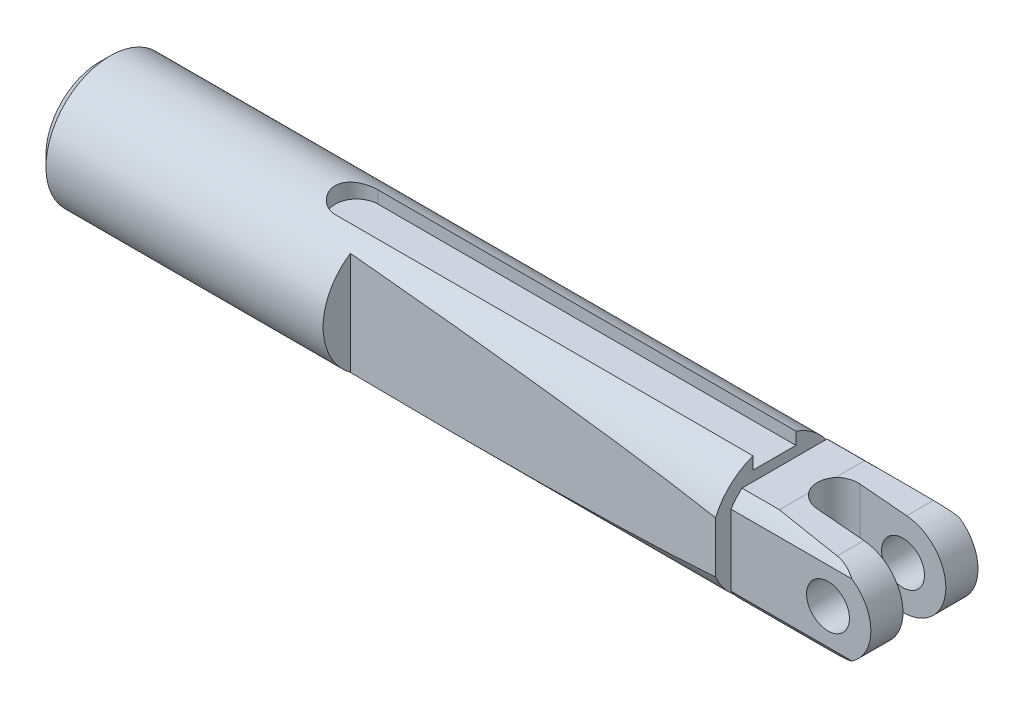
from build123d import *

# Parameters (mm, degrees)
SKIZZE1_W                            = 63
SKIZZE1_H                            = 6
SKIZZE2_W                            = 18
SKIZZE2_H                            = 14
AUFSATZ_LINEAR_AUSTRAGEN1_DEPTH      = 9
SCHNITT_LINEAR_AUSTRAGEN1_DEPTH      = 72.909665553
SCHNITT_LINEAR_AUSTRAGEN1_DEPTH_BACK = 72.909665553
SKIZZE3_R                            = 2
SCHNITT_LINEAR_AUSTRAGEN2_DEPTH      = 72.909665553
SCHNITT_LINEAR_AUSTRAGEN2_DEPTH_BACK = 72.909665553
SKIZZE4_W                            = 15
SKIZZE4_H                            = 4
SCHNITT_LINEAR_AUSTRAGEN4_DEPTH      = 72.909665553
SCHNITT_LINEAR_AUSTRAGEN4_DEPTH_BACK = 72.909665553
SCHNITT_LINEAR_AUSTRAGEN5_DEPTH      = 5
SCHNITT_LINEAR_AUSTRAGEN5_DEPTH_BACK = 65.02343321
SKIZZE9_OUTSIDE_W                    = 32.83
SKIZZE9_OUTSIDE_H                    = 36.83
SKIZZE9_OUTSIDE_R                    = 6
SKIZZE11_W                           = 0.94
SKIZZE11_H                           = 2.5
SKIZZE14_W                           = 4
SKIZZE14_H                           = 3
SCHNITT_LINEAR_AUSTRAGEN7_DEPTH      = 45
FASE1_SIZE                           = 1
SCHNITT_LINEAR_START                 = -6.0000001
SCHNITT_LINEAR_AUSTRAGEN8_DEPTH      = 12.0000001
SCHNITT_LINEAR_AUSTRAGEN9_DEPTH      = 68.535176128
SCHNITT_LINEAR_AUSTRAGEN9_DEPTH_BACK = 68.535176128
SKIZZE16_W                           = 13.06
SKIZZE16_H                           = 1
VERRUNDUNG2_R                        = 2
VERRUNDUNG3_R                        = 2
VERRUNDUNG4_R                        = 2


with BuildPart() as part:
    # Skizze1 → Rotation1 (revolve)
    with BuildSketch(Plane.XY, mode=Mode.PRIVATE) as rotation1_sk:
        with Locations((21.5, 3)):
            Rectangle(SKIZZE1_W, SKIZZE1_H)
    revolve(rotation1_sk.sketch.rotate(Axis((0, 0, 0), (1, 0, 0)), 90), axis=Axis((0, 0, 0), (1, 0, 0)))

    # Skizze2 → Aufsatz-Linear austragen1 (add, symmetric)
    with BuildSketch(Plane(origin=(0, 0, 0), x_dir=(1, 0, 0), z_dir=(0, 1, 0))):
        with Locations((62, 0)):
            Rectangle(SKIZZE2_W, SKIZZE2_H)
    extrude(amount=AUFSATZ_LINEAR_AUSTRAGEN1_DEPTH, both=True)

    # Skizze3 → Schnitt-Linear austragen1 (cut, two sides: drawn at the far end of the back side and taken through both)
    with BuildSketch(Plane.XY.offset(-SCHNITT_LINEAR_AUSTRAGEN1_DEPTH_BACK)):
        with Locations((63, 0)):
            Circle(SKIZZE3_R)
    extrude(amount=SCHNITT_LINEAR_AUSTRAGEN1_DEPTH + SCHNITT_LINEAR_AUSTRAGEN1_DEPTH_BACK, mode=Mode.SUBTRACT)

    # Skizze4 → Schnitt-Linear austragen2 (cut, two sides: drawn at the far end of the back side and taken through both)
    with BuildSketch(Plane(origin=(0, 0, 0), x_dir=(1, 0, 0), z_dir=(0, 1, 0)).offset(-SCHNITT_LINEAR_AUSTRAGEN2_DEPTH_BACK)):
        with Locations((64.5, 0)):
            Rectangle(SKIZZE4_W, SKIZZE4_H)
    extrude(amount=SCHNITT_LINEAR_AUSTRAGEN2_DEPTH + SCHNITT_LINEAR_AUSTRAGEN2_DEPTH_BACK, mode=Mode.SUBTRACT)

    # Skizze7 → Schnitt-Linear austragen4 (cut, two sides: drawn at the far end of the back side and taken through both)
    with BuildSketch(Plane(origin=(0, 0, 0), x_dir=(1, 0, 0), z_dir=(0, 1, 0)).offset(-SCHNITT_LINEAR_AUSTRAGEN4_DEPTH_BACK)):
        Polygon((53, -5.5), (17, -3.580275313), (16.870966522, -6), (53, -6), align=None)
    extrude(amount=SCHNITT_LINEAR_AUSTRAGEN4_DEPTH + SCHNITT_LINEAR_AUSTRAGEN4_DEPTH_BACK, mode=Mode.SUBTRACT)

    # Skizze9 outside → Schnitt-Linear austragen5 (cut, two sides: drawn at the far end of the back side and taken through both)
    with BuildSketch(Plane.ZY.offset(-53).offset(-SCHNITT_LINEAR_AUSTRAGEN5_DEPTH_BACK)):
        Rectangle(SKIZZE9_OUTSIDE_W, SKIZZE9_OUTSIDE_H)
        Circle(SKIZZE9_OUTSIDE_R, mode=Mode.SUBTRACT)
    extrude(amount=SCHNITT_LINEAR_AUSTRAGEN5_DEPTH + SCHNITT_LINEAR_AUSTRAGEN5_DEPTH_BACK, mode=Mode.SUBTRACT)

    # Skizze11 → Schnitt-Rotation1 (revolve, cut)
    with BuildSketch(Plane.XY, mode=Mode.PRIVATE) as schnitt_rotation1_sk:
        with Locations((53.47, 4.75)):
            Rectangle(SKIZZE11_W, SKIZZE11_H)
    revolve(schnitt_rotation1_sk.sketch.rotate(Axis((0, 0, 0), (1, 0, 0)), 90), axis=Axis((0, 0, 0), (1, 0, 0)), mode=Mode.SUBTRACT)

    # Skizze14 → Schnitt-Linear austragen7 (cut)
    with BuildSketch(Plane(origin=(57, 0, 0), x_dir=(0, 0, -1), z_dir=(1, 0, 0))):
        with Locations((0, 6)):
            Rectangle(SKIZZE14_W, SKIZZE14_H)
        with Locations((0, -6)):
            Rectangle(SKIZZE14_W, SKIZZE14_H)
    extrude(amount=-SCHNITT_LINEAR_AUSTRAGEN7_DEPTH, mode=Mode.SUBTRACT)

    # Fase1
    fase1_edges = [part.edges().sort_by_distance(p)[0] for p in [
        (-10, 0, -6),
    ]]
    chamfer(fase1_edges, length=FASE1_SIZE)

    # Schnitt-Linear austragen8: read off the stored shape, not the designer's step
    # Schnitt-Linear austragen8 outline → Schnitt-Linear austragen8 (cut)
    with BuildSketch(Plane.XY.offset(SCHNITT_LINEAR_START)):
        with BuildLine():
            Line((53.94, 7), (53.94, 4.5))
            Line((53.94, 4.5), (57.44, 4.5))
            Line((57.44, 4.5), (63.347474122, 3.984879137))
            ThreePointArc((63.347474122, 3.984879137), (67, 0), (63.347474122, -3.984879137))
            Line((63.347474122, -3.984879137), (57.44, -4.5))
            Line((57.44, -4.5), (53.94, -4.5))
            Line((53.94, -4.5), (53.94, -7))
            Line((53.94, -7), (72, -7))
            Line((72, -7), (72, 7))
            Line((72, 7), (53.94, 7))
        make_face()
    extrude(amount=SCHNITT_LINEAR_AUSTRAGEN8_DEPTH, mode=Mode.SUBTRACT)

    # Skizze16 → Schnitt-Linear austragen9 (cut, two sides: drawn at the far end of the back side and taken through both)
    with BuildSketch(Plane(origin=(0, 0, 0), x_dir=(1, 0, 0), z_dir=(0, 1, 0)).offset(-SCHNITT_LINEAR_AUSTRAGEN9_DEPTH_BACK)):
        with Locations((60.47, 5.5)):
            Rectangle(SKIZZE16_W, SKIZZE16_H)
        with Locations((60.47, -5.5)):
            Rectangle(SKIZZE16_W, SKIZZE16_H)
    extrude(amount=SCHNITT_LINEAR_AUSTRAGEN9_DEPTH + SCHNITT_LINEAR_AUSTRAGEN9_DEPTH_BACK, mode=Mode.SUBTRACT)

    # Verrundung2
    verrundung2_edges = [part.edges().sort_by_distance(p)[0] for p in [
        (12, 5.078427125, 2),
        (12, 5.078427125, -2),
    ]]
    fillet(verrundung2_edges, radius=VERRUNDUNG2_R - 0.0001)  # a hair under: the kernel refuses the full size

    # Verrundung3
    verrundung3_edges = [part.edges().sort_by_distance(p)[0] for p in [
        (12, -5.078427125, 2),
        (12, -5.078427125, -2),
    ]]
    fillet(verrundung3_edges, radius=VERRUNDUNG3_R - 0.0001)  # a hair under: the kernel refuses the full size

    # Verrundung4
    verrundung4_edges = [part.edges().sort_by_distance(p)[0] for p in [
        (57, 0, -2),
        (57, 0, 2),
    ]]
    fillet(verrundung4_edges, radius=VERRUNDUNG4_R - 0.0001)  # a hair under: the kernel refuses the full size


solid = part.part
